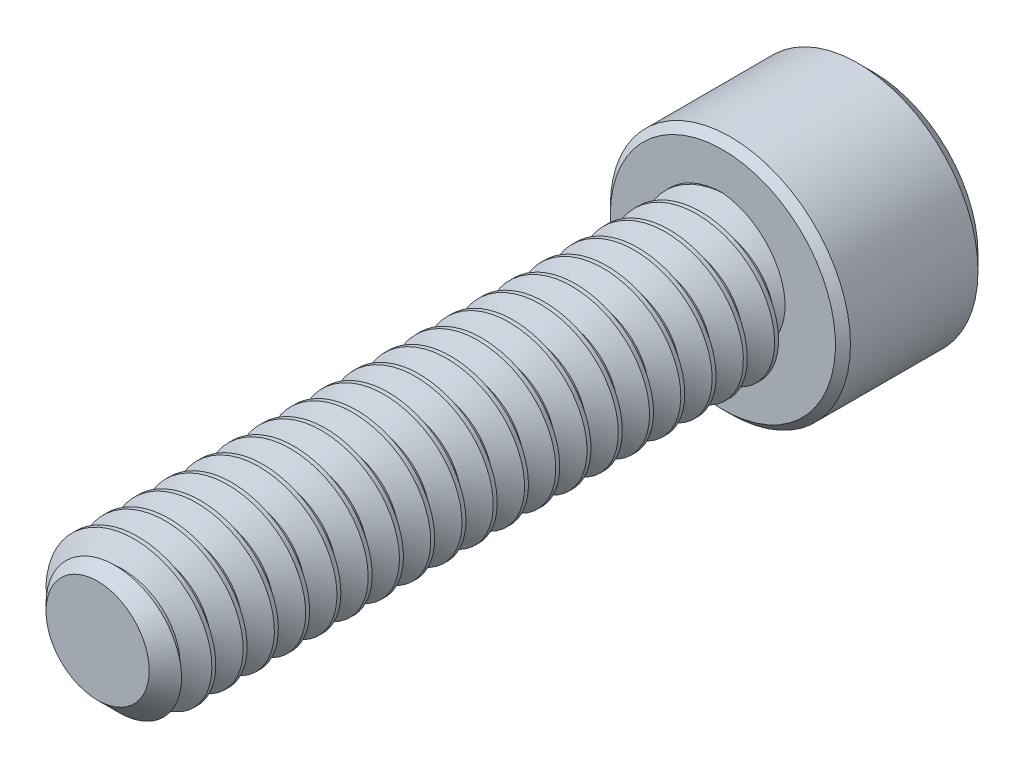
from build123d import *

# Parameters (mm, degrees)
SKETCH1_R          = 0.762
EXTRUDE1_DEPTH     = 6.35
CHAMFER3_SIZE      = 0.238125
CUT_SWEEP1_PITCH   = 0.3175
SKETCH6_R          = 1.2192
EXTRUDE2_DEPTH     = 1.524
CUT_EXTRUDE1_DEPTH = 0.9525
SKETCH8_R          = 0.733234842
CUT_EXTRUDE2_DEPTH = 0.1524
CUT_EXTRUDE2_DRAFT = -45
CHAMFER1_SIZE      = 0.1524
CHAMFER2_SIZE      = 0.0762


with BuildPart() as part:
    # Sketch1 → Extrude1 (new body)
    with BuildSketch(Plane.XY):
        Circle(SKETCH1_R)
    extrude(amount=-EXTRUDE1_DEPTH)

    # Chamfer3
    chamfer3_edges = [part.edges().sort_by_distance(p)[0] for p in [
        (-0.762, 0, 0),
    ]]
    chamfer(chamfer3_edges, length=CHAMFER3_SIZE)

    # Cut-Sweep1: the profile of Sketch3 profile screwed along a right-hand helix of 21 turns, 6 arcs to a turn; built about Z, then put on its axis
    cut_sweep1_z = Axis((0, 0, 0), (0, 0, 1))
    cut_sweep1_corners = [(0.7623, 0, -0.277985705), (0.555777701, 0, -0.15875), (0.555777701, 0, -0.1190625), (0.7623, 0, 0.000173205)]
    with BuildLine(mode=Mode.PRIVATE) as cut_sweep1_profile:
        Line(cut_sweep1_corners[0], cut_sweep1_corners[1])
        Line(cut_sweep1_corners[1], cut_sweep1_corners[2])
        Line(cut_sweep1_corners[2], cut_sweep1_corners[3])
        Line(cut_sweep1_corners[3], cut_sweep1_corners[0])
    cut_sweep1_cap = Face(cut_sweep1_profile.wire())
    cut_sweep1_turn_angles = [0, 30, 60, 90, 120, 150, 180, 210, 240, 270, 300, 330, 360]
    cut_sweep1_turn_weights = [1, 0.8660254037844387, 1, 0.8660254037844387, 1, 0.8660254037844387, 1, 0.8660254037844387, 1, 0.8660254037844387, 1, 0.8660254037844387, 1]
    cut_sweep1_turn_rails = [Edge.make_bspline([Vector(p[0], p[1], 0).rotate(cut_sweep1_z, cut_sweep1_turn_angles[k]) / cut_sweep1_turn_weights[k] + Vector(0, 0, p[2] + CUT_SWEEP1_PITCH * cut_sweep1_turn_angles[k] / 360) for k in range(13)], [0, 0, 0, 1, 1, 2, 2, 3, 3, 4, 4, 5, 5, 6, 6, 6], 2, cut_sweep1_turn_weights) for p in cut_sweep1_corners]
    cut_sweep1_turn_sides = [Face.make_surface_from_curves(cut_sweep1_turn_rails[p[0]], cut_sweep1_turn_rails[p[1]]) for p in [(0, 1), (1, 2), (2, 3), (3, 0)]]
    cut_sweep1 = Plane(origin=(0, 0, 0), x_dir=(0, 1, 0), z_dir=(0, 0, -1)) * Solid(Shell([*[p.moved(Location((0, 0, CUT_SWEEP1_PITCH * i))) for i in range(21) for p in cut_sweep1_turn_sides], cut_sweep1_cap, cut_sweep1_cap.rotate(cut_sweep1_z, 7560).moved(Location((0, 0, CUT_SWEEP1_PITCH * 7560 / 360)))]))
    add(cut_sweep1, mode=Mode.SUBTRACT)

    # Sketch6 → Extrude2 (add)
    with BuildSketch(Plane(origin=(0, 0, -6.35), x_dir=(-1, 0, 0), z_dir=(0, 0, -1))):
        with Locations(Location((0, 0, 0), (0, 0, 180))):
            Circle(SKETCH6_R)
    extrude(amount=EXTRUDE2_DEPTH)

    # Sketch7 → Cut-Extrude1 (cut)
    with BuildSketch(Plane(origin=(0, 0, -7.874), x_dir=(-1, 0, 0), z_dir=(0, 0, -1))):
        Polygon((0, 0.733234842), (-0.635, 0.366617421), (-0.635, -0.366617421), (0, -0.733234842), (0.635, -0.366617421), (0.635, 0.366617421), align=None)
    extrude(amount=-CUT_EXTRUDE1_DEPTH, mode=Mode.SUBTRACT)


with BuildPart() as cut_extrude2_tool:
    # Sketch8 → Cut-Extrude2 (with draft: the straight prism first)
    with BuildSketch(Plane(origin=(0, 0, -7.874), x_dir=(-1, 0, 0), z_dir=(0, 0, -1))):
        Circle(SKETCH8_R)
    extrude(amount=-CUT_EXTRUDE2_DEPTH)
    # Cut-Extrude2: the draft: its side faces are tilted about the plane it starts from
    cut_extrude2_sides = [cut_extrude2_tool.faces().sort_by_distance(p)[0] for p in [
        (0.733234842, 0, -7.7978),
    ]]
    draft(cut_extrude2_sides, Plane(origin=(0, 0, -7.874), x_dir=(-1, 0, 0), z_dir=(0, 0, -1)), CUT_EXTRUDE2_DRAFT)


with BuildPart() as part_1:
    add(part.part)

    # Cut-Extrude2: cut by cut_extrude2_tool
    add(cut_extrude2_tool.part, mode=Mode.SUBTRACT)

    # Chamfer1
    chamfer1_edges = [part_1.edges().sort_by_distance(p)[0] for p in [
        (-1.2192, 0, -7.874),
    ]]
    chamfer(chamfer1_edges, length=CHAMFER1_SIZE)

    # Chamfer2
    chamfer2_edges = [part_1.edges().sort_by_distance(p)[0] for p in [
        (-1.2192, 0, -6.35),
    ]]
    chamfer(chamfer2_edges, length=CHAMFER2_SIZE)


solid = part_1.part
